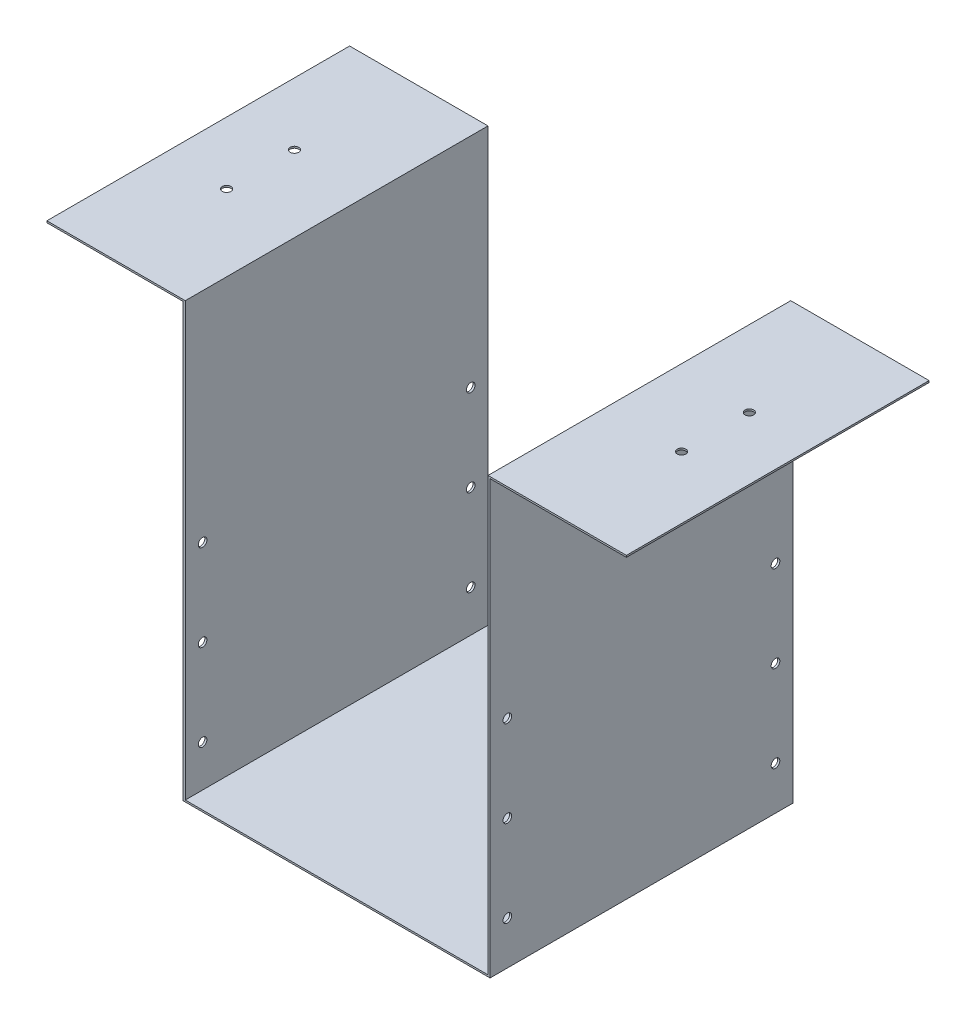
from build123d import *

# Parameters (mm, degrees)
SKETCH1_W           = 175
SKETCH1_H           = 175
BOSS_EXTRUDE1_DEPTH = 1
SKETCH2_W           = 1.2
SKETCH2_H           = 175
BOSS_EXTRUDE2_DEPTH = 250
SKETCH3_W           = 80
SKETCH3_H           = 175
BOSS_EXTRUDE3_DEPTH = 1
SKETCH4_R           = 2.5
CUT_EXTRUDE1_DEPTH  = 10
SKETCH6_R           = 2.5
CUT_EXTRUDE2_DEPTH  = 300


with BuildPart() as part:
    # Sketch1 → Boss-Extrude1 (new body)
    with BuildSketch(Plane(origin=(0, 0, 0), x_dir=(1, 0, 0), z_dir=(0, 1, 0))):
        Rectangle(SKETCH1_W, SKETCH1_H)
    extrude(amount=BOSS_EXTRUDE1_DEPTH)

    # Sketch2 → Boss-Extrude2 (add)
    with BuildSketch(Plane.XZ):
        with Locations((-88.1, 0)):
            Rectangle(SKETCH2_W, SKETCH2_H)
        with Locations((88.1, 0)):
            Rectangle(SKETCH2_W, SKETCH2_H)
    extrude(amount=-BOSS_EXTRUDE2_DEPTH)

    # Sketch3 → Boss-Extrude3 (add)
    with BuildSketch(Plane(origin=(0, 250, 0), x_dir=(1, 0, 0), z_dir=(0, 1, 0))):
        with Locations((-127.5, 0)):
            Rectangle(SKETCH3_W, SKETCH3_H)
        with Locations((127.5, 0)):
            Rectangle(SKETCH3_W, SKETCH3_H)
    extrude(amount=BOSS_EXTRUDE3_DEPTH)

    # Sketch4 → Cut-Extrude1 (cut)
    with BuildSketch(Plane(origin=(0, 251, 0), x_dir=(1, 0, 0), z_dir=(0, 1, 0))):
        with Locations((131.5, 19.6)):
            Circle(SKETCH4_R)
        with Locations((131.5, -19.6)):
            Circle(SKETCH4_R)
        with Locations((-131.5, -19.6)):
            Circle(SKETCH4_R)
        with Locations((-131.5, 19.6)):
            Circle(SKETCH4_R)
    extrude(amount=-CUT_EXTRUDE1_DEPTH, mode=Mode.SUBTRACT)

    # Sketch6 → Cut-Extrude2 (cut)
    with BuildSketch(Plane(origin=(88.7, 0, 0), x_dir=(0, 0, -1), z_dir=(1, 0, 0))):
        with Locations((77.5, 25)):
            Circle(SKETCH6_R)
        with Locations((77.5, 75)):
            Circle(SKETCH6_R)
        with Locations((77.5, 125)):
            Circle(SKETCH6_R)
        with Locations((-77.5, 125)):
            Circle(SKETCH6_R)
        with Locations((-77.5, 75)):
            Circle(SKETCH6_R)
        with Locations((-77.5, 25)):
            Circle(SKETCH6_R)
    extrude(amount=-CUT_EXTRUDE2_DEPTH, mode=Mode.SUBTRACT)


solid = part.part
